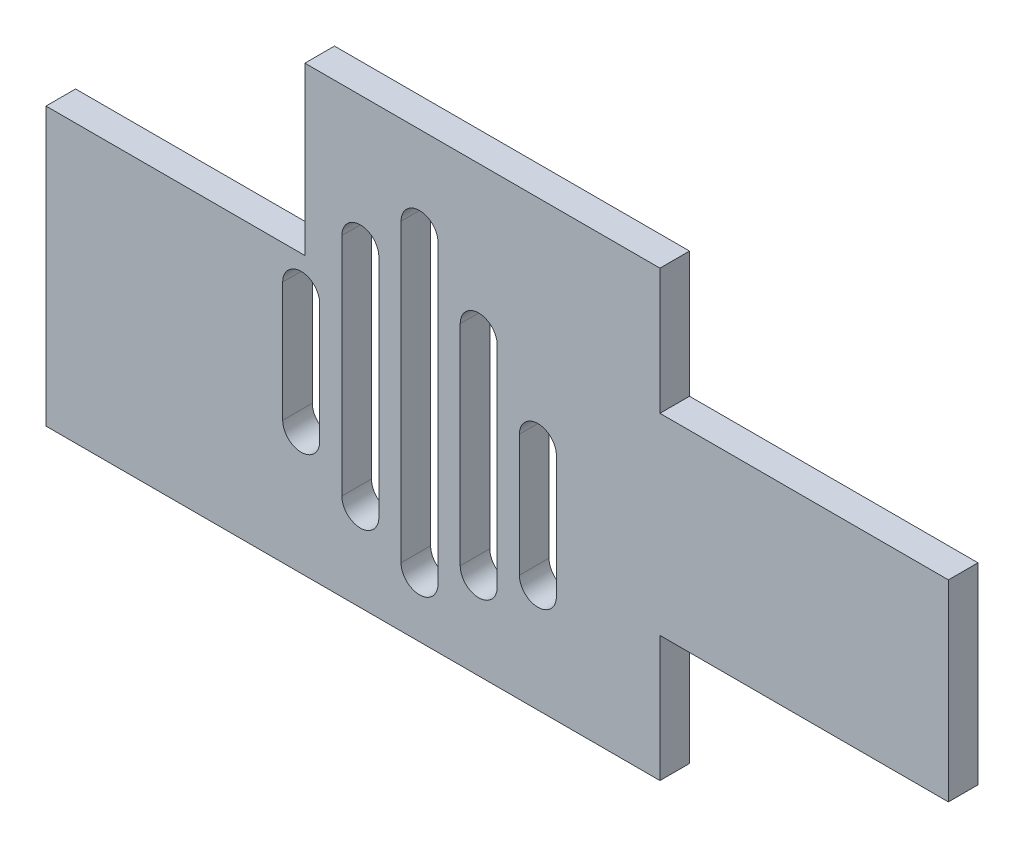
from build123d import *

# Parameters (mm, degrees)
BOSS_EXTRUDE1_DEPTH = 4


with BuildPart() as part:
    # Sketch1 → Boss-Extrude1 (new body)
    with BuildSketch(Plane.XY):
        Polygon((30.862718171, 33.994054131), (69.862718171, 33.994054131), (69.862718171, 7.994054131), (30.862718171, 7.994054131), (30.862718171, -9.005945869), (-52.137281829, -9.005945869), (-52.137281829, 28.472304637), (-17.137281829, 28.472304637), (-17.137281829, 50.994054131), (30.862718171, 50.994054131), align=None)
        with BuildLine():
            Line((-4.137281829, 38.994054131), (-4.137281829, -1.005945869))
            ThreePointArc((-4.137281829, -1.005945869), (-1.637281829, -3.505945869), (0.862718171, -1.005945869))
            Line((0.862718171, -1.005945869), (0.862718171, 38.994054131))
            ThreePointArc((0.862718171, 38.994054131), (-1.637281829, 41.494054131), (-4.137281829, 38.994054131))
        make_face(mode=Mode.SUBTRACT)
        with BuildLine():
            Line((-12.137281829, 33.312431903), (-12.137281829, 2.809827896))
            ThreePointArc((-12.137281829, 2.809827896), (-9.637281829, 0.309827896), (-7.137281829, 2.809827896))
            Line((-7.137281829, 2.809827896), (-7.137281829, 33.312431903))
            ThreePointArc((-7.137281829, 33.312431903), (-9.637281829, 35.812431903), (-12.137281829, 33.312431903))
        make_face(mode=Mode.SUBTRACT)
        with BuildLine():
            Line((-15.137281829, 23.861283589), (-15.137281829, 7.683449462))
            ThreePointArc((-15.137281829, 7.683449462), (-17.637281829, 5.183449462), (-20.137281829, 7.683449462))
            Line((-20.137281829, 7.683449462), (-20.137281829, 23.861283589))
            ThreePointArc((-20.137281829, 23.861283589), (-17.637281829, 26.361283589), (-15.137281829, 23.861283589))
        make_face(mode=Mode.SUBTRACT)
        with BuildLine():
            Line((3.862718171, 30.994054131), (3.862718171, 2.647434443))
            ThreePointArc((3.862718171, 2.647434443), (6.362718171, 0.147434443), (8.862718171, 2.647434443))
            Line((8.862718171, 2.647434443), (8.862718171, 30.994054131))
            ThreePointArc((8.862718171, 30.994054131), (6.362718171, 33.494054131), (3.862718171, 30.994054131))
        make_face(mode=Mode.SUBTRACT)
        with BuildLine():
            Line((11.862718171, 22.048271006), (11.862718171, 5.538473012))
            ThreePointArc((11.862718171, 5.538473012), (14.362718171, 3.038473012), (16.862718171, 5.538473012))
            Line((16.862718171, 5.538473012), (16.862718171, 22.048271006))
            ThreePointArc((16.862718171, 22.048271006), (14.362718171, 24.548271006), (11.862718171, 22.048271006))
        make_face(mode=Mode.SUBTRACT)
    extrude(amount=BOSS_EXTRUDE1_DEPTH)


solid = part.part
